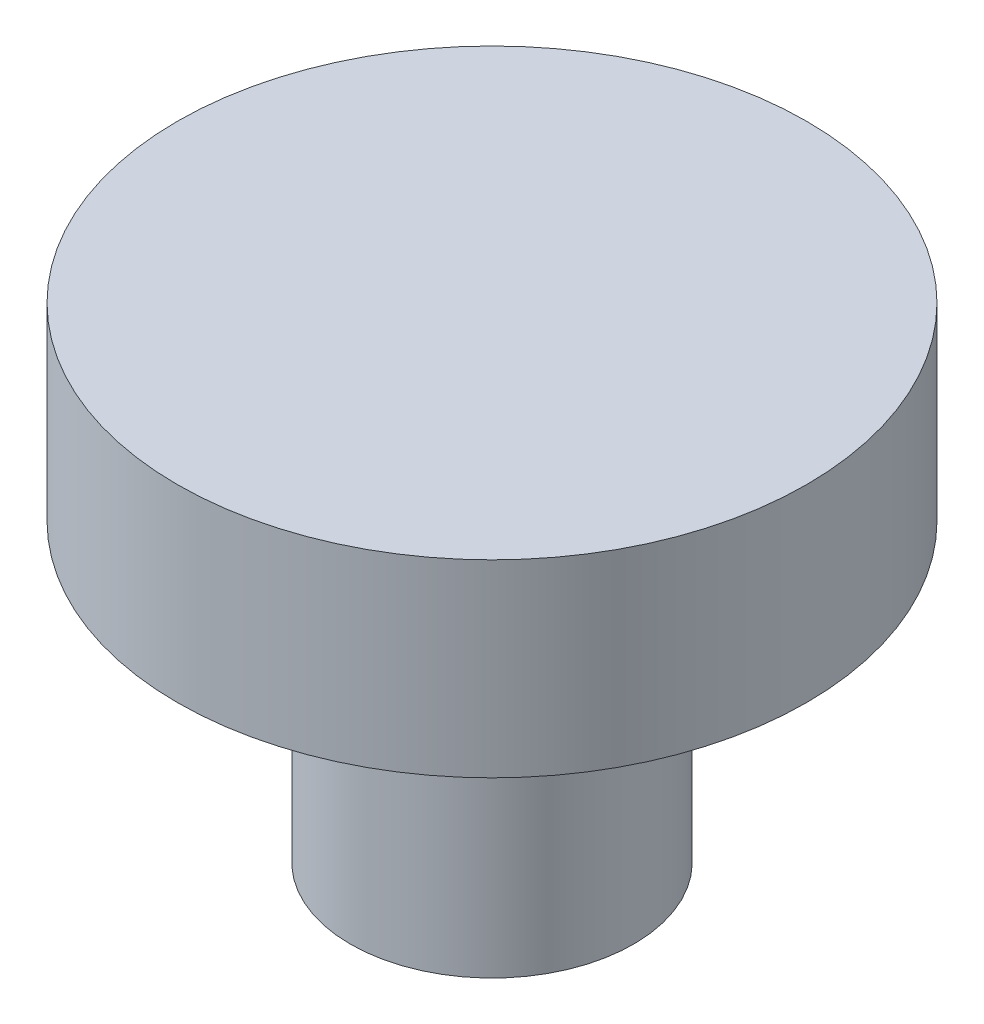
from build123d import *


with BuildPart() as part:
    # Sketch1 → Revolve1 (revolve)
    with BuildSketch(Plane(origin=(0, 0, 0), x_dir=(0, 0, -1), z_dir=(1, 0, 0))):
        Polygon((0, 0), (0, -47), (22.5, -47), (22.5, 0), (50, 0), (50, 30), (0, 30), align=None)
    revolve(axis=Axis((0, 30, 0), (0, -1, 0)))


solid = part.part
